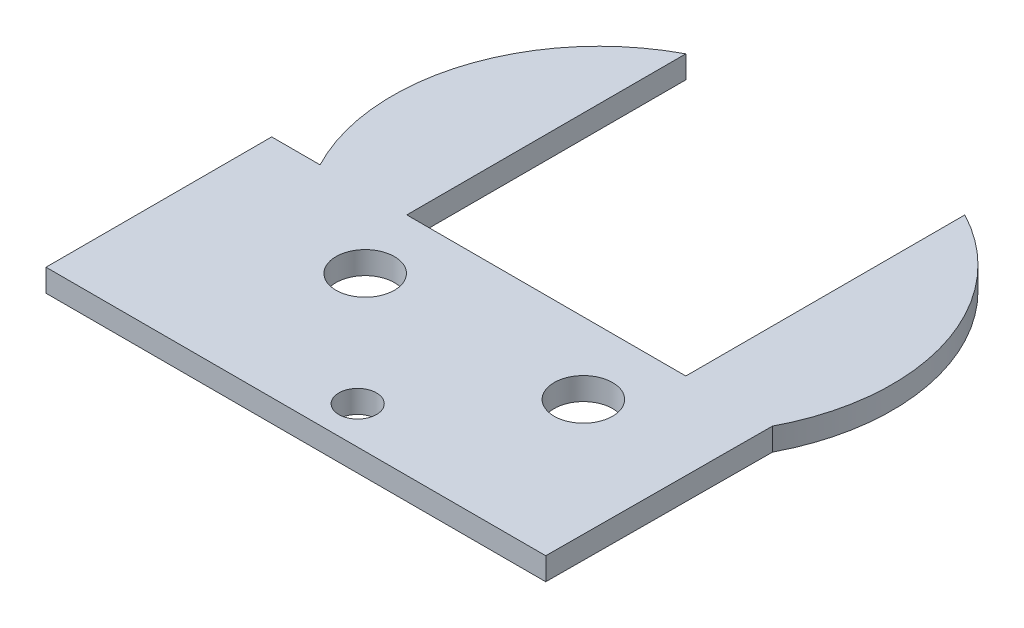
from build123d import *

# Parameters (mm, degrees)
BOSS_EXTRUDE1_DEPTH = 3
SKETCH2_R           = 2.5
CUT_EXTRUDE1_DEPTH  = 20
SKETCH3_W           = 5
SKETCH3_H           = 5
CUT_EXTRUDE2_DEPTH  = 10
SKETCH4_R           = 3.881431072
CUT_EXTRUDE3_DEPTH  = 10


with BuildPart() as part:
    # Sketch1 → Boss-Extrude1 (new body)
    with BuildSketch(Plane(origin=(0, 0, 0), x_dir=(1, 0, 0), z_dir=(0, 1, 0))):
        with BuildLine():
            Line((17.315765865, 0), (17.315765865, 37.089615131))
            ThreePointArc((17.315765865, 37.089615131), (30.761203346, 20.932304167), (28.843619216, 0))
            Line((28.843619216, 0), (28.698297383, -30))
            Line((28.698297383, -30), (-37.733548075, -30))
            Line((-37.733548075, -30), (-37.733548075, 0))
            Line((-37.733548075, 0), (-31.301702617, 0))
            ThreePointArc((-31.301702617, 0), (-33.219286746, 20.932304167), (-19.773849266, 37.089615131))
            Line((-19.773849266, 37.089615131), (-19.773849266, 0))
            Line((-19.773849266, 0), (17.315765865, 0))
        make_face()
    extrude(amount=BOSS_EXTRUDE1_DEPTH)

    # Sketch2 → Cut-Extrude1 (cut)
    with BuildSketch(Plane(origin=(0, 3, 0), x_dir=(1, 0, 0), z_dir=(0, 1, 0))):
        with Locations((-1.301702617, -25)):
            Circle(SKETCH2_R)
    extrude(amount=-CUT_EXTRUDE1_DEPTH, mode=Mode.SUBTRACT)

    # Sketch3 → Cut-Extrude2 (cut)
    with BuildSketch(Plane.XZ):
        with Locations((13.198297383, 9.5)):
            Rectangle(SKETCH3_W, SKETCH3_H)
        Polygon((-13.079021817, 6.884821213), (-13.127461291, 11.884586569), (-18.127226647, 11.836147095), (-18.078787173, 6.836381738), align=None)
    extrude(amount=-CUT_EXTRUDE2_DEPTH, mode=Mode.SUBTRACT)

    # Sketch4 → Cut-Extrude3 (cut)
    with BuildSketch(Plane.XZ):
        with Locations((13.198297383, 9.5)):
            Circle(SKETCH4_R)
        with Locations((-15.801702617, 9.5)):
            Circle(SKETCH4_R)
    extrude(amount=-CUT_EXTRUDE3_DEPTH, mode=Mode.SUBTRACT)


solid = part.part
